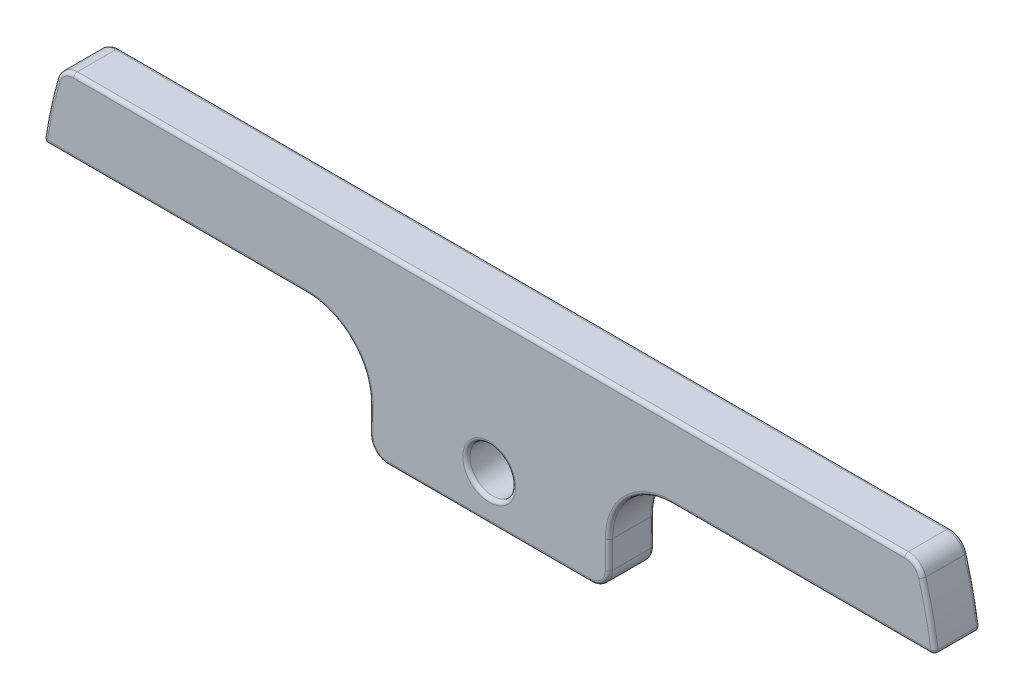
from build123d import *

# Parameters (mm, degrees)
SKETCH1_R      = 3.175
EXTRUDE1_DEPTH = 6.35
FILLET1_R      = 2.54
FILLET2_R      = 0.508


with BuildPart() as part:
    # Sketch1 → Extrude1 (new body)
    with BuildSketch(Plane.XY):
        with BuildLine():
            Line((0.61084709, 15.08125), (37.30625, 15.08125))
            ThreePointArc((37.30625, 15.08125), (43.480176083, 12.523926083), (46.0375, 6.35))
            Line((46.0375, 6.35), (46.0375, 0))
            Line((46.0375, 0), (79.375, 0))
            Line((79.375, 0), (79.375, 6.35))
            ThreePointArc((79.375, 6.35), (81.932323917, 12.523926083), (88.10625, 15.08125))
            Line((88.10625, 15.08125), (124.80165291, 15.08125))
            ThreePointArc((124.80165291, 15.08125), (123.843311895, 20.290353362), (122.448791702, 25.4))
            Line((122.448791702, 25.4), (2.963708298, 25.4))
            ThreePointArc((2.963708298, 25.4), (1.569188105, 20.290353362), (0.61084709, 15.08125))
        make_face()
        with Locations((62.70625, 6.35)):
            Circle(SKETCH1_R, mode=Mode.SUBTRACT)
    extrude(amount=EXTRUDE1_DEPTH)

    # Fillet1
    fillet1_edges = [part.edges().sort_by_distance(p)[0] for p in [
        (122.448791702, 25.4, 3.175),
        (2.963708298, 25.4, 3.175),
        (46.0375, 0, 3.175),
        (79.375, 0, 3.175),
    ]]
    fillet(fillet1_edges, radius=FILLET1_R)

    # Fillet2
    fillet2_edges = [part.edges().sort_by_distance(p)[0] for p in [
        (59.53125, 6.35, 0),
        (3.319643181, 24.887555165, 0),
        (1.362390487, 19.35018035, 0),
        (18.958548545, 15.08125, 0),
        (43.480176083, 12.523926083, 0),
        (46.0375, 4.445, 0),
        (46.781448776, 0.743948776, 0),
        (62.70625, 0, 0),
        (78.631051224, 0.743948776, 0),
        (79.375, 4.445, 0),
        (81.932323917, 12.523926083, 0),
        (106.453951455, 15.08125, 0),
        (124.050109513, 19.35018035, 0),
        (122.092856819, 24.887555165, 0),
        (62.70625, 25.4, 0),
        (59.53125, 6.35, 6.35),
        (106.453951455, 15.08125, 6.35),
        (81.932323917, 12.523926083, 6.35),
        (79.375, 4.445, 6.35),
        (78.631051224, 0.743948776, 6.35),
        (62.70625, 0, 6.35),
        (46.781448776, 0.743948776, 6.35),
        (46.0375, 4.445, 6.35),
        (43.480176083, 12.523926083, 6.35),
        (18.958548545, 15.08125, 6.35),
        (1.362390487, 19.35018035, 6.35),
        (3.319643181, 24.887555165, 6.35),
        (62.70625, 25.4, 6.35),
        (122.092856819, 24.887555165, 6.35),
        (124.050109513, 19.35018035, 6.35),
        (124.80165291, 15.08125, 3.175),
        (0.61084709, 15.08125, 3.175),
    ]]
    fillet(fillet2_edges, radius=FILLET2_R)


solid = part.part
